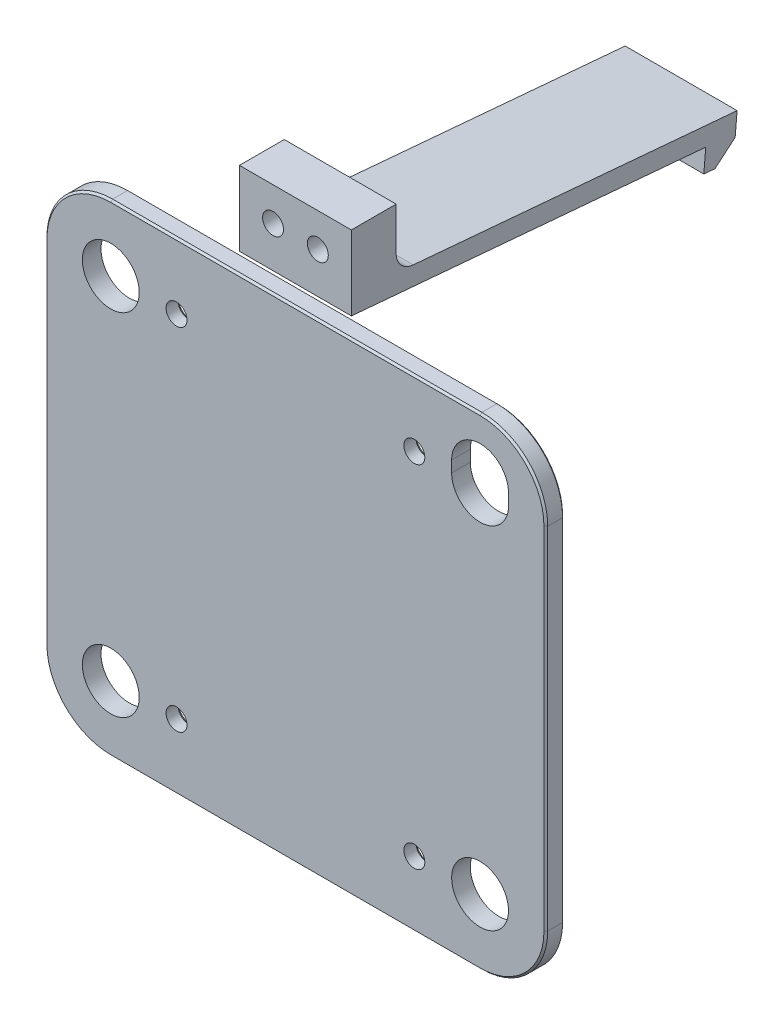
from build123d import *

# Parameters (mm, degrees)
SKETCH1_R                                          = 7.625
BOSS_EXTRUDE1_DEPTH                                = 5
CSK_FOR_10_FLAT_HEAD_MACHINE_SCREW_100_D           = 5.6134
CSK_FOR_10_FLAT_HEAD_MACHINE_SCREW_100_CSINK_D     = 9.779
CSK_FOR_10_FLAT_HEAD_MACHINE_SCREW_100_CSINK_ANGLE = 100
MIRROR1_START                                      = 1.747676612
MIRROR1_OUTLINE_R                                  = 7.625
MIRROR1_OUTLINE_R_2                                = 2.8067
MIRROR1_DEPTH                                      = 3.252323388
MIRROR1_2_OUTLINE_R                                = 7.625
MIRROR1_2_DEPTH                                    = 1.747676612
BOSS_EXTRUDE2_DEPTH                                = 15
CUT_EXTRUDE1_START                                 = -10
CUT_EXTRUDE1_DEPTH                                 = 143.620092016
CSK_FOR_10_FLAT_HEAD_MACHINE_SCREW_2_AT_COUNT      = 2
CSK_FOR_10_FLAT_HEAD_MACHINE_SCREW_2_AT_PITCH      = 12
CUT_EXTRUDE2_DEPTH                                 = 150.277724809
CHAMFER1_SIZE                                      = 0.5


with BuildPart() as part:
    # Sketch1 → Boss-Extrude1 (new body)
    with BuildSketch(Plane.XY):
        with BuildLine():
            Line((0, 0), (-67.125, 0))
            Line((-67.125, 0), (-67.125, 47))
            ThreePointArc((-67.125, 47), (-61.962757018, 59.462757018), (-49.5, 64.625))
            Line((-49.5, 64.625), (0, 64.625))
            Line((0, 64.625), (0, 0))
        make_face()
        with Locations((-49.5, 47)):
            Circle(SKETCH1_R, mode=Mode.SUBTRACT)
    extrude(amount=BOSS_EXTRUDE1_DEPTH)

    # CSK for _10 Flat Head Machine Screw _100 (through all)
    with Locations(Plane(origin=(-31.875, 47, 0), x_dir=(-1, 0, 0), z_dir=(0, 0, -1))):
        with Locations((0, 0)):
            CounterSinkHole(CSK_FOR_10_FLAT_HEAD_MACHINE_SCREW_100_D / 2, CSK_FOR_10_FLAT_HEAD_MACHINE_SCREW_100_CSINK_D / 2, counter_sink_angle=CSK_FOR_10_FLAT_HEAD_MACHINE_SCREW_100_CSINK_ANGLE)

    # Mirror1: read off the stored shape, not the designer's step
    # Mirror1 outline → Mirror1 (add)
    with BuildSketch(Plane.XY.offset(MIRROR1_START)):
        with BuildLine():
            Line((49.5, 64.625), (0, 64.625))
            Line((0, 64.625), (0, 0))
            Line((0, 0), (-67.125, 0))
            Line((-67.125, 0), (-67.125, -47))
            ThreePointArc((-67.125, -47), (-61.962757018, -59.462757018), (-49.5, -64.625))
            Line((-49.5, -64.625), (49.5, -64.625))
            ThreePointArc((49.5, -64.625), (61.962757018, -59.462757018), (67.125, -47))
            Line((67.125, -47), (67.125, 47))
            ThreePointArc((67.125, 47), (61.962757018, 59.462757018), (49.5, 64.625))
        make_face()
        with Locations((-49.5, -47)):
            Circle(MIRROR1_OUTLINE_R, mode=Mode.SUBTRACT)
        with Locations((-31.875, -47)):
            Circle(MIRROR1_OUTLINE_R_2, mode=Mode.SUBTRACT)
        with Locations((31.875, -47)):
            Circle(MIRROR1_OUTLINE_R_2, mode=Mode.SUBTRACT)
        with Locations((49.5, -47)):
            Circle(MIRROR1_OUTLINE_R, mode=Mode.SUBTRACT)
        with Locations((31.875, 47)):
            Circle(MIRROR1_OUTLINE_R_2, mode=Mode.SUBTRACT)
        with Locations((49.5, 47)):
            Circle(MIRROR1_OUTLINE_R, mode=Mode.SUBTRACT)
    extrude(amount=MIRROR1_DEPTH)

    # Mirror1 2 outline → Mirror1 2 (add)
    with BuildSketch(Plane.XY):
        with BuildLine():
            Line((49.5, 64.625), (0, 64.625))
            Line((0, 64.625), (0, 0))
            Line((0, 0), (-67.125, 0))
            Line((-67.125, 0), (-67.125, -47))
            ThreePointArc((-67.125, -47), (-61.962757018, -59.462757018), (-49.5, -64.625))
            Line((-49.5, -64.625), (49.5, -64.625))
            ThreePointArc((49.5, -64.625), (61.962757018, -59.462757018), (67.125, -47))
            Line((67.125, -47), (67.125, 47))
            ThreePointArc((67.125, 47), (61.962757018, 59.462757018), (49.5, 64.625))
        make_face()
        with Locations((-49.5, -47)):
            Circle(MIRROR1_2_OUTLINE_R, mode=Mode.SUBTRACT)
        with Locations((49.5, -47)):
            Circle(MIRROR1_2_OUTLINE_R, mode=Mode.SUBTRACT)
        with Locations((49.5, 47)):
            Circle(MIRROR1_2_OUTLINE_R, mode=Mode.SUBTRACT)
    extrude(amount=MIRROR1_2_DEPTH)

    # Mirror1 3: loft between two sections, ruled curve by curve
    mirror1_3_from = [
        Edge.make_three_point_arc((29.0683, 47, 1.747676712), (31.875, 49.8067, 1.747676712), (34.6817, 47, 1.747676712)),
        Edge.make_three_point_arc((34.6817, 47, 1.747676712), (31.875, 44.1933, 1.747676712), (29.0683, 47, 1.747676712)),
    ]
    mirror1_3_to = [
        Edge.make_three_point_arc((26.9855, 47, 0), (31.875, 51.8895, 0), (36.7645, 47, 0)),
        Edge.make_three_point_arc((36.7645, 47, 0), (31.875, 42.1105, 0), (26.9855, 47, 0)),
    ]
    mirror1_3 = Solid(Shell([*[Face.make_surface_from_curves(mirror1_3_from[k], mirror1_3_to[k]) for k in range(2)], Face(Wire(mirror1_3_from)), Face(Wire(mirror1_3_to))]))
    add(mirror1_3, mode=Mode.SUBTRACT)

    # Mirror1 4: loft between two sections, ruled curve by curve
    mirror1_4_from = [
        Edge.make_three_point_arc((-34.6817, -47, 1.747676712), (-31.875, -44.1933, 1.747676712), (-29.0683, -47, 1.747676712)),
        Edge.make_three_point_arc((-29.0683, -47, 1.747676712), (-31.875, -49.8067, 1.747676712), (-34.6817, -47, 1.747676712)),
    ]
    mirror1_4_to = [
        Edge.make_three_point_arc((-36.7645, -47, 0), (-31.875, -42.1105, 0), (-26.9855, -47, 0)),
        Edge.make_three_point_arc((-26.9855, -47, 0), (-31.875, -51.8895, 0), (-36.7645, -47, 0)),
    ]
    mirror1_4 = Solid(Shell([*[Face.make_surface_from_curves(mirror1_4_from[k], mirror1_4_to[k]) for k in range(2)], Face(Wire(mirror1_4_from)), Face(Wire(mirror1_4_to))]))
    add(mirror1_4, mode=Mode.SUBTRACT)

    # Mirror1 5: loft between two sections, ruled curve by curve
    mirror1_5_from = [
        Edge.make_three_point_arc((29.0683, -47, 1.747676712), (31.875, -44.1933, 1.747676712), (34.6817, -47, 1.747676712)),
        Edge.make_three_point_arc((34.6817, -47, 1.747676712), (31.875, -49.8067, 1.747676712), (29.0683, -47, 1.747676712)),
    ]
    mirror1_5_to = [
        Edge.make_three_point_arc((26.9855, -47, 0), (31.875, -42.1105, 0), (36.7645, -47, 0)),
        Edge.make_three_point_arc((36.7645, -47, 0), (31.875, -51.8895, 0), (26.9855, -47, 0)),
    ]
    mirror1_5 = Solid(Shell([*[Face.make_surface_from_curves(mirror1_5_from[k], mirror1_5_to[k]) for k in range(2)], Face(Wire(mirror1_5_from)), Face(Wire(mirror1_5_to))]))
    add(mirror1_5, mode=Mode.SUBTRACT)

    # Sketch8 → Cut-Extrude2 (cut, through all)
    with BuildSketch(Plane(origin=(0, 0, 0), x_dir=(-1, 0, 0), z_dir=(0, 0, -1))):
        with BuildLine():
            Line((-57.125, 47), (-57.125, 50))
            ThreePointArc((-57.125, 50), (-49.5, 57.625), (-41.875, 50))
            Line((-41.875, 50), (-41.875, 47))
            ThreePointArc((-41.875, 47), (-49.5, 39.375), (-57.125, 47))
        make_face()
    extrude(amount=-CUT_EXTRUDE2_DEPTH, mode=Mode.SUBTRACT)

    # Chamfer1
    chamfer1_edges = [part.edges().sort_by_distance(p)[0] for p in [
        (-61.962757018, 59.462757018, 5),
        (-67.125, 0, 5),
        (67.125, 0, 5),
        (61.962757018, 59.462757018, 5),
        (61.962757018, 59.462757018, 0),
        (67.125, 0, 0),
        (-61.962757018, -59.462757018, 5),
        (0, -64.625, 5),
        (0, -64.625, 0),
        (-61.962757018, -59.462757018, 0),
        (61.962757018, -59.462757018, 5),
        (61.962757018, -59.462757018, 0),
        (-67.125, 0, 0),
        (-61.962757018, 59.462757018, 0),
        (0, 64.625, 0),
        (0, 64.625, 5),
    ]]
    chamfer(chamfer1_edges, length=CHAMFER1_SIZE)


with BuildPart() as body_2:
    # Sketch2 → Boss-Extrude2 (new, symmetric)
    with BuildSketch(Plane(origin=(0, 0, 0), x_dir=(0, 0, -1), z_dir=(1, 0, 0))):
        with BuildLine():
            Line((-5, 70), (90, 61.688576965))
            Line((90, 61.688576965), (89.477065544, 55.711408776))
            Line((89.477065544, 55.711408776), (92.465649638, 55.449941548))
            Line((92.465649638, 55.449941548), (97.882401842, 59.995136325))
            Line((97.882401842, 59.995136325), (98.405336298, 65.972304514))
            Line((98.405336298, 65.972304514), (11.564221286, 73.569917605))
            ThreePointArc((11.564221286, 73.569917605), (8.313613316, 75.172940057), (7, 78.550891095))
            Line((7, 78.550891095), (7, 89.969235225))
            Line((7, 89.969235225), (-5, 89.969235225))
            Line((-5, 89.969235225), (-5, 75.019099188))
            Line((-5, 75.019099188), (-5, 70))
        make_face()
    extrude(amount=BOSS_EXTRUDE2_DEPTH, both=True)

    # Sketch3 → Cut-Extrude1 (cut, through all)
    with BuildSketch(Plane.XY.offset(5).offset(CUT_EXTRUDE1_START)):
        with BuildLine():
            Line((-6, 86.969235225), (6, 86.969235225))
            ThreePointArc((6, 86.969235225), (12, 80.969235225), (6, 74.969235225))
            Line((6, 74.969235225), (-6, 74.969235225))
            ThreePointArc((-6, 74.969235225), (-12, 80.969235225), (-6, 86.969235225))
        make_face()
    extrude(amount=-CUT_EXTRUDE1_DEPTH, mode=Mode.SUBTRACT)

    # Sketch4 → CSK for _10 Flat Head Machine Screw  2 (revolve, cut)
    with BuildSketch(Plane(origin=(-6, 80.969235225, -5), x_dir=(0, 1, 0), z_dir=(1, 0, 0))):
        Polygon((0, 0), (0, 10), (2.8067, 10), (2.8067, 1.747676712), (4.8895, 0), align=None)
    csk_for_10_flat_head_machine_screw_2 = revolve(axis=Axis((-6, 80.969235225, -11.35), (0, 0, 1)), mode=Mode.SUBTRACT)

    # CSK for _10 Flat Head Machine Screw 2 at: CSK for _10 Flat Head Machine Screw  2 ×2
    with Locations(*[(i * CSK_FOR_10_FLAT_HEAD_MACHINE_SCREW_2_AT_PITCH, 0, 0) for i in range(1, CSK_FOR_10_FLAT_HEAD_MACHINE_SCREW_2_AT_COUNT)]):
        add(csk_for_10_flat_head_machine_screw_2, mode=Mode.SUBTRACT)


solid = Compound([part.part, body_2.part])
